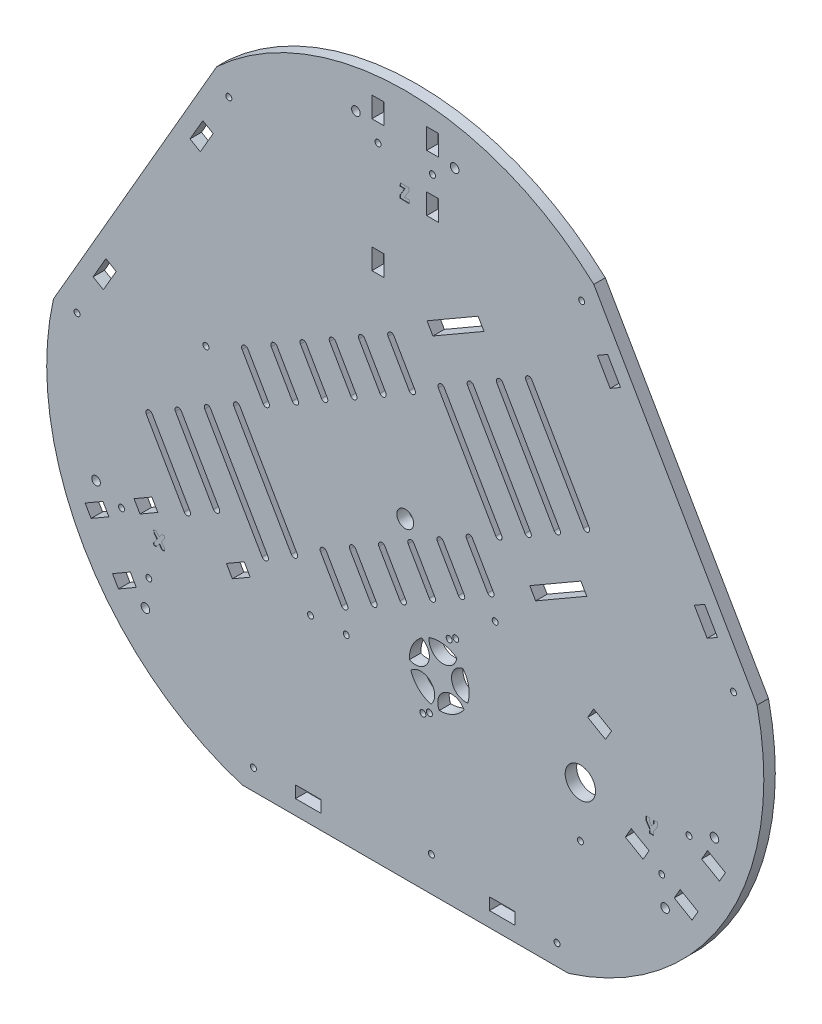
from build123d import *

# Parameters (mm, degrees)
SKETCH1_R                 = 5
BOSS_EXTRUDE1_DEPTH       = 6.8
SKETCH2_R                 = 1.775
CUT_EXTRUDE1_DEPTH        = 6.8
CIRPATTERN4_COUNT         = 3
SKETCH6_R                 = 1.775
SKETCH6_W                 = 7.08
SKETCH6_H                 = 12.2
CUT_EXTRUDE5_DEPTH        = 6.8
CIRPATTERN1_COUNT         = 3
SKETCH7_R                 = 2.55
CUT_EXTRUDE6_DEPTH        = 6.8
CIRPATTERN2_COUNT         = 3
SKETCH11_R                = 2.125
CUT_EXTRUDE10_DEPTH       = 10
CUT_EXTRUDE11_DEPTH       = 0.25
SKETCH15_R                = 1.775
SKETCH15_R_2              = 9
CUT_EXTRUDE14_DEPTH       = 307.036519333
SKETCH16_R                = 1.775
CUT_EXTRUDE15_DEPTH       = 307.036519333
BOSS_EXTRUDE3_OUTLINE_R   = 1.775
BOSS_EXTRUDE3_DEPTH       = 6.8
BOSS_EXTRUDE3_2_OUTLINE_R = 2.125
BOSS_EXTRUDE3_2_DEPTH     = 6.8
CUT_EXTRUDE19_DEPTH       = 10
CUT_EXTRUDE20_DEPTH       = 6.8
CUT_EXTRUDE21_DEPTH       = 6.8


# Read off the part's stored shape, not the designer's step: Boss-Extrude3, Cut-Extrude20, Cut-Extrude21
with BuildPart() as part:
    # Sketch1 → Boss-Extrude1 (new body)
    with BuildSketch(Plane.XY):
        with BuildLine():
            Line((-96.81218614, -185), (96.81218614, -185))
            ThreePointArc((96.81218614, -185), (190.525588833, -110), (208.62079277, 8.658187407))
            Line((208.62079277, 8.658187407), (111.80860663, 176.341812593))
            ThreePointArc((111.80860663, 176.341812593), (0, 220), (-111.80860663, 176.341812593))
            Line((-111.80860663, 176.341812593), (-208.62079277, 8.658187407))
            ThreePointArc((-208.62079277, 8.658187407), (-190.525588833, -110), (-96.81218614, -185))
        make_face()
        Circle(SKETCH1_R, mode=Mode.SUBTRACT)
    extrude(amount=BOSS_EXTRUDE1_DEPTH)

    # Sketch2 → Cut-Extrude1 (cut)
    with BuildSketch(Plane.XY.offset(6.8)):
        with Locations((-104.614548758, 164.322286341)):
            Circle(SKETCH2_R)
        with Locations(Location((-194.614548758, 8.437713659, 0), (0, 0, 180))):
            Circle(SKETCH2_R)
        Polygon((-120.043676147, 144.478253786), (-127.643676147, 131.314667649), (-121.512216288, 127.774667649), (-113.912216288, 140.938253786), align=None)
        Polygon((-171.412216288, 41.345332351), (-179.012216288, 28.181746214), (-185.143676147, 31.721746214), (-177.543676147, 44.885332351), align=None)
    cut_extrude1 = extrude(amount=-CUT_EXTRUDE1_DEPTH, mode=Mode.SUBTRACT)

    # CirPattern4: Cut-Extrude1 ×3 about axis
    cirpattern4_axis = Axis((0, 0, 0), (0, 0, 1))
    for i in range(1, CIRPATTERN4_COUNT):
        add(cut_extrude1.rotate(cirpattern4_axis, i * 360 / CIRPATTERN4_COUNT), mode=Mode.SUBTRACT)

    # Sketch6 → Cut-Extrude5 (cut)
    with BuildSketch(Plane.XY.offset(6.8)):
        with Locations((-16.14, 184.95)):
            Circle(SKETCH6_R)
        with Locations(Location((16.14, 184.95, 0), (0, 0, 180))):
            Circle(SKETCH6_R)
        with Locations((-16.24, 201.7)):
            Rectangle(SKETCH6_W, SKETCH6_H)
        with Locations((-16.24, 123.7)):
            Rectangle(SKETCH6_W, SKETCH6_H)
        with Locations((16.24, 201.7)):
            Rectangle(SKETCH6_W, SKETCH6_H)
        with Locations((16.24, 168.2)):
            Rectangle(SKETCH6_W, SKETCH6_H)
    cut_extrude5 = extrude(amount=-CUT_EXTRUDE5_DEPTH, mode=Mode.SUBTRACT)

    # CirPattern1: Cut-Extrude5 ×3 about axis
    cirpattern1_axis = Axis((0, 0, 0), (0, 0, 1))
    for i in range(1, CIRPATTERN1_COUNT):
        add(cut_extrude5.rotate(cirpattern1_axis, i * 360 / CIRPATTERN1_COUNT), mode=Mode.SUBTRACT)

    # Sketch7 → Cut-Extrude6 (cut)
    with BuildSketch(Plane.XY.offset(6.8)):
        with Locations((-154.066728647, -122.769878732)):
            Circle(SKETCH7_R)
        with Locations((-183.355198125, -72.040761521)):
            Circle(SKETCH7_R)
    cut_extrude6 = extrude(amount=-CUT_EXTRUDE6_DEPTH, mode=Mode.SUBTRACT)

    # CirPattern2: Cut-Extrude6 ×3 about axis
    cirpattern2_axis = Axis((0, 0, 0), (0, 0, 1))
    for i in range(1, CIRPATTERN2_COUNT):
        add(cut_extrude6.rotate(cirpattern2_axis, i * 360 / CIRPATTERN2_COUNT), mode=Mode.SUBTRACT)

    # Sketch11 → Cut-Extrude10 (cut)
    with BuildSketch(Plane(origin=(0, 0, 0), x_dir=(-1, 0, 0), z_dir=(0, 0, -1))):
        with Locations((84.524446081, 6.400635095)):
            Circle(SKETCH11_R)
        with Locations((59.524446081, -36.900635095)):
            Circle(SKETCH11_R)
        with Locations((-70.379364486, 38.099364905)):
            Circle(SKETCH11_R)
        with Locations((-45.379364486, 81.400635095)):
            Circle(SKETCH11_R)
    extrude(amount=-CUT_EXTRUDE10_DEPTH, mode=Mode.SUBTRACT)

    # Sketch12 → Cut-Extrude11 (cut)
    with BuildSketch(Plane.XY.offset(6.8)):
        with BuildLine():
            Line((-2.982465327, 169.305886651), (-0.653369569, 169.305886651))
            add(Edge.make_bspline(
                [(-0.653369569, 169.305886651), (-0.517262902, 169.305886651), (-0.517262902, 169.226875742)],
                knots=[0, 0, 0, 1, 1, 1], degree=2))
            add(Edge.make_bspline(
                [(-0.517262902, 169.226875742), (-0.517262902, 169.07587453), (-3.224889569, 164.634468469), (-3.224889569, 164.615850288)],
                knots=[0, 0, 0, 1, 2, 2, 2], degree=2))
            add(Edge.make_bspline(
                [(-3.224889569, 164.615850288), (-3.224889569, 164.593508469), (-3.195100478, 164.286967864)],
                knots=[0, 0, 0, 1, 1, 1], degree=2))
            add(Edge.make_bspline(
                [(-3.195100478, 164.286967864), (-3.150416842, 163.612640592), (-3.103677448, 163.25024544)],
                knots=[0, 0, 0, 1, 1, 1], degree=2))
            add(Edge.make_bspline(
                [(-3.103677448, 163.25024544), (-3.083818055, 163.124068469), (-2.861253205, 163.124068469)],
                knots=[0, 0, 0, 1, 1, 1], degree=2))
            add(Edge.make_bspline(
                [(-2.861253205, 163.124068469), (-2.368957448, 163.124068469), (-0.404739266, 163.06243453), (0.087556492, 163.06243453)],
                knots=[0, 0, 0, 1, 2, 2, 2], degree=2))
            add(Edge.make_bspline(
                [(0.087556492, 163.06243453), (0.441263158, 163.06243453), (1.816797704, 163.002856348), (2.17050437, 163.002856348)],
                knots=[0, 0, 0, 1, 2, 2, 2], degree=2))
            add(Edge.make_bspline(
                [(2.17050437, 163.002856348), (2.294198916, 163.002856348), (2.350868007, 163.125309683)],
                knots=[0, 0, 0, 1, 1, 1], degree=2))
            add(Edge.make_bspline(
                [(2.350868007, 163.125309683), (2.472080128, 164.012272106), (2.472080128, 164.944732711)],
                knots=[0, 0, 0, 1, 1, 1], degree=2))
            add(Edge.make_bspline(
                [(2.472080128, 164.944732711), (2.472080128, 165.063462408), (2.379415886, 165.063462409)],
                knots=[0, 0, 0, 1, 1, 1], degree=2))
            add(Edge.make_bspline(
                [(2.379415886, 165.063462409), (2.186640127, 165.063462409), (1.873466789, 164.995622408)],
                knots=[0, 0, 0, 1, 1, 1], degree=2))
            add(Edge.make_bspline(
                [(1.873466789, 164.995622408), (1.435784372, 164.965833318), (1.31457225, 164.963350894)],
                knots=[0, 0, 0, 1, 1, 1], degree=2))
            add(Edge.make_bspline(
                [(1.31457225, 164.963350894), (0.707270432, 164.942250288), (-0.408462903, 164.942250287)],
                knots=[0, 0, 0, 1, 1, 1], degree=2))
            add(Edge.make_bspline(
                [(-0.408462903, 164.942250287), (-0.469708295, 164.942250288), (-0.494829138, 164.914762164)],
                knots=[0, 0, 0, 1, 1, 1], degree=2))
            add(Edge.make_bspline(
                [(-0.494829138, 164.914762164), (-0.361971597, 165.211552177), (0.781316494, 167.042575139)],
                knots=[0, 0, 0, 1, 1, 1], degree=2))
            add(Edge.make_bspline(
                [(0.781316494, 167.042575139), (1.889602553, 168.863239379), (2.243309219, 169.379118167)],
                knots=[0, 0, 0, 1, 1, 1], degree=2))
            add(Edge.make_bspline(
                [(2.243309219, 169.379118167), (2.350868007, 169.565687863), (2.350868007, 169.676970287)],
                knots=[0, 0, 0, 1, 1, 1], degree=2))
            add(Edge.make_bspline(
                [(2.350868007, 169.676970287), (2.350868006, 170.529178778), (2.240826792, 170.953634536)],
                knots=[0, 0, 0, 1, 1, 1], degree=2))
            add(Edge.make_bspline(
                [(2.240826792, 170.953634536), (2.176710429, 171.124068469), (2.05549831, 171.124068469)],
                knots=[0, 0, 0, 1, 1, 1], degree=2))
            add(Edge.make_bspline(
                [(2.05549831, 171.124068469), (1.281059522, 171.124068469), (-1.943260478, 171.168752106), (-2.717699263, 171.168752106)],
                knots=[0, 0, 0, 1, 2, 2, 2], degree=2))
            add(Edge.make_bspline(
                [(-2.717699263, 171.168752106), (-2.861253205, 171.168752107), (-2.861253205, 171.067399379)],
                knots=[0, 0, 0, 1, 1, 1], degree=2))
            add(Edge.make_bspline(
                [(-2.861253205, 171.067399379), (-2.861253205, 170.808839379), (-3.103677448, 169.609130288), (-3.103677448, 169.43206362)],
                knots=[0, 0, 0, 1, 2, 2, 2], degree=2))
            add(Edge.make_bspline(
                [(-3.103677448, 169.43206362), (-3.103677448, 169.305886651), (-2.982465327, 169.305886651)],
                knots=[0, 0, 0, 1, 1, 1], degree=2))
        make_face()
        with BuildLine():
            Line((149.501075716, -83.073126272), (149.501075716, -81.297960212))
            add(Edge.make_bspline(
                [(149.501075716, -81.297960212), (149.501075716, -81.012520212), (149.387310868, -81.012520212)],
                knots=[0, 0, 0, 1, 1, 1], degree=2))
            add(Edge.make_bspline(
                [(149.387310868, -81.012520212), (149.039810262, -81.012520212), (147.706476929, -81.095254757), (147.362699959, -81.095254757)],
                knots=[0, 0, 0, 1, 2, 2, 2], degree=2))
            Line((147.362699959, -81.095254757), (147.230316929, -81.095254757))
            add(Edge.make_bspline(
                [(147.230316929, -81.095254757), (147.198045413, -81.106425666), (147.198045413, -81.226396575)],
                knots=[0, 0, 0, 1, 1, 1], degree=2))
            add(Edge.make_bspline(
                [(147.198045413, -81.226396575), (147.198045413, -81.496127484), (147.319257535, -82.668529909), (147.319257535, -82.938260818)],
                knots=[0, 0, 0, 1, 2, 2, 2], degree=2))
            add(Edge.make_bspline(
                [(147.319257535, -82.938260818), (147.319257535, -83.11614203), (146.760362987, -83.780539608)],
                knots=[0, 0, 0, 1, 1, 1], degree=2))
            add(Edge.make_bspline(
                [(146.760362987, -83.780539608), (146.358249048, -84.353087484), (146.107136319, -84.619094754)],
                knots=[0, 0, 0, 1, 1, 1], degree=2))
            add(Edge.make_bspline(
                [(146.107136319, -84.619094754), (145.805560563, -84.341916572), (145.40592905, -83.776815969)],
                knots=[0, 0, 0, 1, 1, 1], degree=2))
            add(Edge.make_bspline(
                [(145.40592905, -83.776815969), (144.895015111, -83.07188506), (144.89501511, -82.915919)],
                knots=[0, 0, 0, 1, 1, 1], degree=2))
            Line((144.89501511, -82.915919), (144.89501511, -81.189160212))
            add(Edge.make_bspline(
                [(144.89501511, -81.189160212), (144.89501511, -81.091531121), (144.773802989, -81.091531121)],
                knots=[0, 0, 0, 1, 1, 1], degree=2))
            add(Edge.make_bspline(
                [(144.773802989, -81.091531121), (144.433749656, -81.091531121), (143.117793292, -81.012520212), (142.782704807, -81.012520212)],
                knots=[0, 0, 0, 1, 2, 2, 2], degree=2))
            add(Edge.make_bspline(
                [(142.782704807, -81.012520212), (142.713196929, -81.012520212), (142.713196929, -81.218949303)],
                knots=[0, 0, 0, 1, 1, 1], degree=2))
            Line((142.713196929, -81.218949303), (142.713196929, -83.268384458))
            add(Edge.make_bspline(
                [(142.713196929, -83.268384458), (142.713196931, -83.403249919), (142.84309755, -83.632020842)],
                knots=[0, 0, 0, 1, 1, 1], degree=2))
            add(Edge.make_bspline(
                [(142.84309755, -83.632020842), (144.124726624, -85.613615966), (144.840828437, -86.584554142)],
                knots=[0, 0, 0, 1, 1, 1], degree=2))
            add(Edge.make_bspline(
                [(144.840828437, -86.584554142), (145.016227232, -86.805877783), (145.016227232, -87.008583242)],
                knots=[0, 0, 0, 1, 1, 1], degree=2))
            add(Edge.make_bspline(
                [(145.016227232, -87.008583242), (145.016227232, -87.293208697), (144.89501511, -88.51774203), (144.89501511, -88.840418393)],
                knots=[0, 0, 0, 1, 2, 2, 2], degree=2))
            add(Edge.make_bspline(
                [(144.89501511, -88.840418393), (144.89501511, -88.975283845), (145.041051468, -88.990178393)],
                knots=[0, 0, 0, 1, 1, 1], degree=2))
            add(Edge.make_bspline(
                [(145.041051468, -88.990178393), (145.272304797, -89.012520212), (146.061638139, -89.012520212)],
                knots=[0, 0, 0, 1, 1, 1], degree=2))
            add(Edge.make_bspline(
                [(146.061638139, -89.012520212), (146.889022383, -89.012520212), (147.105381171, -88.990178393)],
                knots=[0, 0, 0, 1, 1, 1], degree=2))
            add(Edge.make_bspline(
                [(147.105381171, -88.990178393), (147.240246626, -88.975283848), (147.247693898, -88.971560212)],
                knots=[0, 0, 0, 1, 1, 1], degree=2))
            add(Edge.make_bspline(
                [(147.247693898, -88.971560212), (147.319257535, -88.956665666), (147.319257535, -88.847865666)],
                knots=[0, 0, 0, 1, 1, 1], degree=2))
            add(Edge.make_bspline(
                [(147.319257535, -88.847865666), (147.319257535, -88.570687484), (147.198045413, -87.364772333), (147.198045413, -87.042095969)],
                knots=[0, 0, 0, 1, 2, 2, 2], degree=2))
            add(Edge.make_bspline(
                [(147.198045413, -87.042095969), (147.198045413, -86.873717792), (147.358976312, -86.633775982)],
                knots=[0, 0, 0, 1, 1, 1], degree=2))
            add(Edge.make_bspline(
                [(147.358976312, -86.633775982), (148.66127935, -84.983972339), (149.399722989, -83.519497181)],
                knots=[0, 0, 0, 1, 1, 1], degree=2))
            add(Edge.make_bspline(
                [(149.399722989, -83.519497181), (149.501075716, -83.358566272), (149.501075716, -83.073126272)],
                knots=[0, 0, 0, 1, 1, 1], degree=2))
        make_face()
        with BuildLine():
            Line((-143.30056228, -88.039701106), (-143.070550159, -88.039701106))
            add(Edge.make_bspline(
                [(-143.070550159, -88.039701106), (-142.779718642, -88.039701106), (-142.696984097, -87.918488984)],
                knots=[0, 0, 0, 1, 1, 1], degree=2))
            add(Edge.make_bspline(
                [(-142.696984097, -87.918488984), (-142.66347137, -87.812171407), (-142.66347137, -87.296292619)],
                knots=[0, 0, 0, 1, 1, 1], degree=2))
            add(Edge.make_bspline(
                [(-142.66347137, -87.296292619), (-142.663471371, -86.581432015), (-142.757376825, -86.461461106)],
                knots=[0, 0, 0, 1, 1, 1], degree=2))
            add(Edge.make_bspline(
                [(-142.757376825, -86.461461106), (-142.784683492, -86.424224742), (-143.755621673, -85.212103531)],
                knots=[0, 0, 0, 1, 1, 1], degree=2))
            add(Edge.make_bspline(
                [(-143.755621673, -85.212103531), (-144.589211977, -84.158430803), (-144.589211977, -84.052113227)],
                knots=[0, 0, 0, 1, 1, 1], degree=2))
            add(Edge.make_bspline(
                [(-144.589211977, -84.052113227), (-144.589211977, -84.007429591), (-142.757376825, -81.737912015), (-142.757376825, -81.600564136)],
                knots=[0, 0, 0, 1, 2, 2, 2], degree=2))
            Line((-142.757376825, -81.600564136), (-142.757376825, -80.175807772))
            add(Edge.make_bspline(
                [(-142.757376825, -80.175807772), (-142.757376826, -80.069490197), (-142.930719855, -80.069490197)],
                knots=[0, 0, 0, 1, 1, 1], degree=2))
            Line((-142.930719855, -80.069490197), (-144.287636218, -80.069490197))
            add(Edge.make_bspline(
                [(-144.287636218, -80.069490197), (-144.396436217, -80.069490194), (-145.10012591, -81.128127763)],
                knots=[0, 0, 0, 1, 1, 1], degree=2))
            add(Edge.make_bspline(
                [(-145.10012591, -81.128127763), (-145.827398642, -82.212830802), (-145.943645916, -82.299288985)],
                knots=[0, 0, 0, 1, 1, 1], degree=2))
            add(Edge.make_bspline(
                [(-145.943645916, -82.299288985), (-145.967228946, -82.299288985), (-147.505750158, -80.136088985), (-147.60958531, -80.136088985)],
                knots=[0, 0, 0, 1, 2, 2, 2], degree=2))
            add(Edge.make_bspline(
                [(-147.60958531, -80.136088985), (-147.677851977, -80.136088985), (-148.124222886, -80.15098353), (-148.237987734, -80.15098353)],
                knots=[0, 0, 0, 1, 2, 2, 2], degree=2))
            add(Edge.make_bspline(
                [(-148.237987734, -80.15098353), (-148.357958643, -80.15098353), (-148.847771977, -80.128641712), (-148.971466515, -80.128641712)],
                knots=[0, 0, 0, 1, 1.999999972, 1.999999972, 1.999999972], degree=2))
            add(Edge.make_bspline(
                [(-148.971466515, -80.128641712), (-149.182860461, -80.12864171), (-149.182860461, -80.239924136)],
                knots=[0, 0, 0, 1, 1, 1], degree=2))
            add(Edge.make_bspline(
                [(-149.182860461, -80.239924136), (-149.182860461, -80.354930197), (-149.115020461, -80.786833227), (-149.115020461, -80.901839288)],
                knots=[0, 0, 0, 1, 2, 2, 2], degree=2))
            add(Edge.make_bspline(
                [(-149.115020461, -80.901839288), (-149.115020461, -80.960990803), (-149.12619137, -81.160399288)],
                knots=[0, 0, 0, 1, 1, 1], degree=2))
            add(Edge.make_bspline(
                [(-149.12619137, -81.160399288), (-149.129915007, -81.375516864), (-149.12619137, -81.494246561)],
                knots=[0, 0, 0, 1, 1, 1], degree=2))
            add(Edge.make_bspline(
                [(-149.12619137, -81.494246561), (-149.118744098, -81.645247773), (-149.08523137, -81.734188379)],
                knots=[0, 0, 0, 1, 1, 1], degree=2))
            ThreePointArc((-149.08523137, -81.734188379), (-148.59193848, -82.343433568), (-148.096916214, -82.951274446))
            add(Edge.make_bspline(
                [(-148.096916214, -82.951274446), (-147.283185319, -83.928418671), (-147.28318531, -84.063284133)],
                knots=[0, 0, 0, 1, 1, 1], degree=2))
            add(Edge.make_bspline(
                [(-147.28318531, -84.063284133), (-147.283185302, -84.241165339), (-148.100639855, -85.235686561)],
                knots=[0, 0, 0, 1, 1, 1], degree=2))
            add(Edge.make_bspline(
                [(-148.100639855, -85.235686561), (-149.081507734, -86.471390803), (-149.085231371, -86.47511444)],
                knots=[0, 0, 0, 1, 1, 1], degree=2))
            add(Edge.make_bspline(
                [(-149.085231371, -86.47511444), (-149.182860461, -86.598808987), (-149.182860461, -87.313669591)],
                knots=[0, 0, 0, 1, 1, 1], degree=2))
            add(Edge.make_bspline(
                [(-149.182860461, -87.313669591), (-149.182860461, -87.426193227), (-149.122467734, -87.884976258), (-149.122467734, -88.126159288), (-148.00052834, -88.126159288)],
                knots=[0, 0, 0, 1, 2, 3, 3, 3], degree=2))
            add(Edge.make_bspline(
                [(-148.00052834, -88.126159288), (-147.653027735, -88.126159288), (-147.560363492, -88.069490197)],
                knots=[0, 0, 0, 1, 1, 1], degree=2))
            add(Edge.make_bspline(
                [(-147.560363492, -88.069490197), (-147.483408343, -88.047148382), (-146.777236229, -87.041456272)],
                knots=[0, 0, 0, 1, 1, 1], degree=2))
            add(Edge.make_bspline(
                [(-146.777236229, -87.041456272), (-146.051204705, -85.964200501), (-145.92875137, -85.857882924)],
                knots=[0, 0, 0, 1, 1, 1], degree=2))
            add(Edge.make_bspline(
                [(-145.92875137, -85.857882924), (-145.908891977, -85.861606561), (-144.366647128, -88.021082924), (-144.262811977, -88.021082924)],
                knots=[0, 0, 0, 1, 2, 2, 2], degree=2))
            add(Edge.make_bspline(
                [(-144.262811977, -88.021082924), (-144.147805916, -88.021082924), (-143.727073795, -88.03597747), (-143.493338037, -88.03597747), (-143.30056228, -88.039701106)],
                knots=[0, 0, 0, 1, 2, 3, 3, 3], degree=2))
        make_face()
    extrude(amount=-CUT_EXTRUDE11_DEPTH, mode=Mode.SUBTRACT)

    # Sketch15 → Cut-Extrude14 (cut, through all)
    with BuildSketch(Plane.XY.offset(6.8)):
        with Locations((-35, -77.012364852)):
            Circle(SKETCH15_R)
        with Locations((53.334591186, -26.012364852)):
            Circle(SKETCH15_R)
        with Locations((103.834591186, -113.480930634)):
            Circle(SKETCH15_R)
        with Locations((15.5, -164.480930634)):
            Circle(SKETCH15_R)
        with Locations((103.824972243, -83.464270135)):
            Circle(SKETCH15_R_2)
    extrude(amount=-CUT_EXTRUDE14_DEPTH, mode=Mode.SUBTRACT)

    # Sketch16 → Cut-Extrude15 (cut, through all)
    with BuildSketch(Plane.XY.offset(6.8)):
        with Locations((26.023702054, -48.708517274)):
            Circle(SKETCH16_R)
        with Locations((29.920816371, -46.458517274)):
            Circle(SKETCH16_R)
        with Locations((14.310889132, -92.421330195)):
            Circle(SKETCH16_R)
        with Locations((10.413774815, -94.671330195)):
            Circle(SKETCH16_R)
        with BuildLine():
            ThreePointArc((20.167295593, -88.314923735), (23.671568639, -77.195916905), (34.832304969, -80.564923735))
            ThreePointArc((34.832304969, -80.564923735), (28.460741801, -86.258274238), (20.167295593, -88.314923735))
        make_face()
        with BuildLine():
            ThreePointArc((3.286042429, -76.049975385), (14.943726253, -75.946775029), (15.18846755, -87.602346407))
            ThreePointArc((15.18846755, -87.602346407), (7.804848155, -83.301971797), (3.286042429, -76.049975385))
        make_face()
        with BuildLine():
            ThreePointArc((9.734107365, -56.204872085), (13.434679153, -67.260097587), (2.425201262, -71.094630027))
            ThreePointArc((2.425201262, -71.094630027), (4.233436685, -62.743501851), (9.734107365, -56.204872085))
        make_face()
        with BuildLine():
            ThreePointArc((30.600483821, -56.204872085), (21.22987914, -63.140577554), (14.180906308, -53.854877555))
            ThreePointArc((14.180906308, -53.854877555), (22.682076654, -52.993971108), (30.600483821, -56.204872085))
        make_face()
        with BuildLine():
            ThreePointArc((37.048548757, -76.049975385), (27.556624781, -69.281251599), (34.209597876, -59.70784095))
            ThreePointArc((34.209597876, -59.70784095), (37.655374671, -67.52689968), (37.048548757, -76.049975385))
        make_face()
    extrude(amount=-CUT_EXTRUDE15_DEPTH, mode=Mode.SUBTRACT)

    # Boss-Extrude3 outline → Boss-Extrude3 (cut)
    with BuildSketch(Plane.XY):
        Polygon((46.696378913, 119.619499193), (43.196378913, 125.68167702), (12.88548978, 108.18167702), (16.38548978, 102.119499193), align=None)
        Polygon((77.32548978, -3.43167702), (107.636378913, 14.06832298), (104.136378913, 20.130500807), (73.82548978, 2.630500807), align=None)
        with Locations((-56.209890648, -77.64161351)):
            Circle(BOSS_EXTRUDE3_OUTLINE_R)
        with Locations((-118.149890648, 29.64161351)):
            Circle(BOSS_EXTRUDE3_OUTLINE_R)
    extrude(amount=BOSS_EXTRUDE3_DEPTH, mode=Mode.SUBTRACT)

    # Boss-Extrude3 2 outline → Boss-Extrude3 2 (add)
    with BuildSketch(Plane.XY):
        with Locations((45.379364486, 81.400635095)):
            Circle(BOSS_EXTRUDE3_2_OUTLINE_R)
        with Locations((-84.524446081, 6.400635095)):
            Circle(BOSS_EXTRUDE3_2_OUTLINE_R)
        with Locations((-59.524446081, -36.900635095)):
            Circle(BOSS_EXTRUDE3_2_OUTLINE_R)
        with Locations((70.379364486, 38.099364905)):
            Circle(BOSS_EXTRUDE3_2_OUTLINE_R)
    extrude(amount=BOSS_EXTRUDE3_2_DEPTH)

    # Sketch23 → Cut-Extrude19 (cut)
    with BuildSketch(Plane.XY.offset(6.8)):
        with BuildLine():
            Line((-93.323829072, 40.64161351), (-80.823829072, 18.990978416))
            ThreePointArc((-80.823829072, 18.990978416), (-81.55587988, 16.258927608), (-84.287930688, 16.990978416))
            Line((-84.287930688, 16.990978416), (-96.787930688, 38.64161351))
            ThreePointArc((-96.787930688, 38.64161351), (-96.05587988, 41.373664318), (-93.323829072, 40.64161351))
        make_face()
        with BuildLine():
            Line((-34.270580418, -61.64161351), (-46.770580418, -39.990978416))
            ThreePointArc((-46.770580418, -39.990978416), (-49.502631226, -39.258927608), (-50.234682034, -41.990978416))
            Line((-50.234682034, -41.990978416), (-37.734682034, -63.64161351))
            ThreePointArc((-37.734682034, -63.64161351), (-35.002631226, -64.373664318), (-34.270580418, -61.64161351))
        make_face()
    extrude(amount=-CUT_EXTRUDE19_DEPTH, mode=Mode.SUBTRACT)

    # Cut-Extrude20 outline → Cut-Extrude20 (cut)
    with BuildSketch(Plane.XY):
        with BuildLine():
            Line((-63.503320997, 28.990978416), (-76.003320997, 50.64161351))
            ThreePointArc((-76.003320997, 50.64161351), (-78.735371805, 51.373664318), (-79.467422612, 48.64161351))
            Line((-79.467422612, 48.64161351), (-66.967422612, 26.990978416))
            ThreePointArc((-66.967422612, 26.990978416), (-64.235371804, 26.258927608), (-63.503320997, 28.990978416))
        make_face()
        with BuildLine():
            ThreePointArc((-20.414173958, -53.64161351), (-17.68212315, -54.373664318), (-16.950072343, -51.64161351))
            Line((-16.950072343, -51.64161351), (-29.450072343, -29.990978416))
            ThreePointArc((-29.450072343, -29.990978416), (-32.182123151, -29.258927608), (-32.914173958, -31.990978416))
            Line((-32.914173958, -31.990978416), (-20.414173958, -53.64161351))
        make_face()
        with BuildLine():
            Line((-28.862304845, 48.990978416), (-41.362304845, 70.64161351))
            ThreePointArc((-41.362304845, 70.64161351), (-44.094355653, 71.373664318), (-44.826406461, 68.64161351))
            Line((-44.826406461, 68.64161351), (-32.326406461, 46.990978416))
            ThreePointArc((-32.326406461, 46.990978416), (-29.594355653, 46.258927608), (-28.862304845, 48.990978416))
        make_face()
        with BuildLine():
            ThreePointArc((14.226842193, -33.64161351), (16.958893001, -34.373664318), (17.690943809, -31.64161351))
            Line((17.690943809, -31.64161351), (5.190943809, -9.990978416))
            ThreePointArc((5.190943809, -9.990978416), (2.458893001, -9.258927608), (1.726842193, -11.990978416))
            Line((1.726842193, -11.990978416), (14.226842193, -33.64161351))
        make_face()
        with BuildLine():
            Line((-15.593665882, -21.990978416), (-3.093665882, -43.64161351))
            ThreePointArc((-3.093665882, -43.64161351), (-0.361615074, -44.373664318), (0.370435733, -41.64161351))
            Line((0.370435733, -41.64161351), (-12.129564267, -19.990978416))
            ThreePointArc((-12.129564267, -19.990978416), (-14.861615075, -19.258927608), (-15.593665882, -21.990978416))
        make_face()
        with BuildLine():
            ThreePointArc((-58.682812921, 60.64161351), (-61.414863729, 61.373664318), (-62.146914536, 58.64161351))
            Line((-62.146914536, 58.64161351), (-49.646914536, 36.990978416))
            ThreePointArc((-49.646914536, 36.990978416), (-46.914863728, 36.258927608), (-46.182812921, 38.990978416))
            Line((-46.182812921, 38.990978416), (-58.682812921, 60.64161351))
        make_face()
        with BuildLine():
            Line((19.047350269, -1.990978416), (31.547350269, -23.64161351))
            ThreePointArc((31.547350269, -23.64161351), (34.279401077, -24.373664318), (35.011451884, -21.64161351))
            Line((35.011451884, -21.64161351), (22.511451884, 0.009021584))
            ThreePointArc((22.511451884, 0.009021584), (19.779401076, 0.741072392), (19.047350269, -1.990978416))
        make_face()
        with BuildLine():
            ThreePointArc((-24.04179677, 80.64161351), (-26.773847578, 81.373664318), (-27.505898385, 78.64161351))
            Line((-27.505898385, 78.64161351), (-15.005898385, 56.990978416))
            ThreePointArc((-15.005898385, 56.990978416), (-12.273847577, 56.258927608), (-11.54179677, 58.990978416))
            Line((-11.54179677, 58.990978416), (-24.04179677, 80.64161351))
        make_face()
        with BuildLine():
            Line((5.778711306, 68.990978416), (-6.721288694, 90.64161351))
            ThreePointArc((-6.721288694, 90.64161351), (-9.453339502, 91.373664318), (-10.185390309, 88.64161351))
            Line((-10.185390309, 88.64161351), (2.314609691, 66.990978416))
            ThreePointArc((2.314609691, 66.990978416), (5.046660499, 66.258927608), (5.778711306, 68.990978416))
        make_face()
        with BuildLine():
            ThreePointArc((48.867858345, -13.64161351), (51.599909153, -14.373664318), (52.33195996, -11.64161351))
            Line((52.33195996, -11.64161351), (39.83195996, 10.009021584))
            ThreePointArc((39.83195996, 10.009021584), (37.099909152, 10.741072392), (36.367858345, 8.009021584))
            Line((36.367858345, 8.009021584), (48.867858345, -13.64161351))
        make_face()
        with BuildLine():
            Line((57.152468036, 20.009021584), (23.099219382, 78.990978416))
            ThreePointArc((23.099219382, 78.990978416), (20.367168574, 79.723029223), (19.635117766, 76.990978416))
            Line((19.635117766, 76.990978416), (53.688366421, 18.009021584))
            ThreePointArc((53.688366421, 18.009021584), (56.420417228, 17.276970777), (57.152468036, 20.009021584))
        make_face()
    extrude(amount=CUT_EXTRUDE20_DEPTH, mode=Mode.SUBTRACT)

    # Cut-Extrude21 outline → Cut-Extrude21 (cut)
    with BuildSketch(Plane.XY):
        with BuildLine():
            Line((74.472976111, 30.009021584), (40.419727457, 88.990978416))
            ThreePointArc((40.419727457, 88.990978416), (37.68767665, 89.723029223), (36.955625842, 86.990978416))
            Line((36.955625842, 86.990978416), (71.008874496, 28.009021584))
            ThreePointArc((71.008874496, 28.009021584), (73.740925303, 27.276970777), (74.472976111, 30.009021584))
        make_face()
        with BuildLine():
            Line((91.793484187, 40.009021584), (57.740235533, 98.990978416))
            ThreePointArc((57.740235533, 98.990978416), (55.008184726, 99.723029223), (54.276133918, 96.990978416))
            Line((54.276133918, 96.990978416), (88.329382572, 38.009021584))
            ThreePointArc((88.329382572, 38.009021584), (91.061433379, 37.276970777), (91.793484187, 40.009021584))
        make_face()
        with BuildLine():
            Line((109.113992263, 50.009021584), (75.060743609, 108.990978416))
            ThreePointArc((75.060743609, 108.990978416), (72.328692802, 109.723029223), (71.596641994, 106.990978416))
            Line((71.596641994, 106.990978416), (105.649890648, 48.009021584))
            ThreePointArc((105.649890648, 48.009021584), (108.381941455, 47.276970777), (109.113992263, 50.009021584))
        make_face()
        with BuildLine():
            Line((-64.091088494, -49.990978416), (-98.144337148, 8.990978416))
            ThreePointArc((-98.144337148, 8.990978416), (-100.876387955, 9.723029223), (-101.608438763, 6.990978416))
            Line((-101.608438763, 6.990978416), (-67.555190109, -51.990978416))
            ThreePointArc((-67.555190109, -51.990978416), (-64.823139302, -52.723029223), (-64.091088494, -49.990978416))
        make_face()
        with BuildLine():
            Line((-81.41159657, -59.990978416), (-115.464845224, -1.009021584))
            ThreePointArc((-115.464845224, -1.009021584), (-118.196896031, -0.276970777), (-118.928946839, -3.009021584))
            Line((-118.928946839, -3.009021584), (-84.875698185, -61.990978416))
            ThreePointArc((-84.875698185, -61.990978416), (-82.143647378, -62.723029223), (-81.41159657, -59.990978416))
        make_face()
        with BuildLine():
            Line((-127.605861375, -59.980164755), (-150.105861375, -21.009021584))
            ThreePointArc((-150.105861375, -21.009021584), (-152.837912182, -20.276970777), (-153.56996299, -23.009021584))
            Line((-153.56996299, -23.009021584), (-131.06996299, -61.980164755))
            ThreePointArc((-131.06996299, -61.980164755), (-128.337912183, -62.712215562), (-127.605861375, -59.980164755))
        make_face()
        with BuildLine():
            Line((-110.2853533, -49.980164755), (-132.7853533, -11.009021584))
            ThreePointArc((-132.7853533, -11.009021584), (-135.517404107, -10.276970777), (-136.249454915, -13.009021584))
            Line((-136.249454915, -13.009021584), (-113.749454915, -51.980164755))
            ThreePointArc((-113.749454915, -51.980164755), (-111.017404108, -52.712215562), (-110.2853533, -49.980164755))
        make_face()
    extrude(amount=CUT_EXTRUDE21_DEPTH, mode=Mode.SUBTRACT)


solid = part.part
